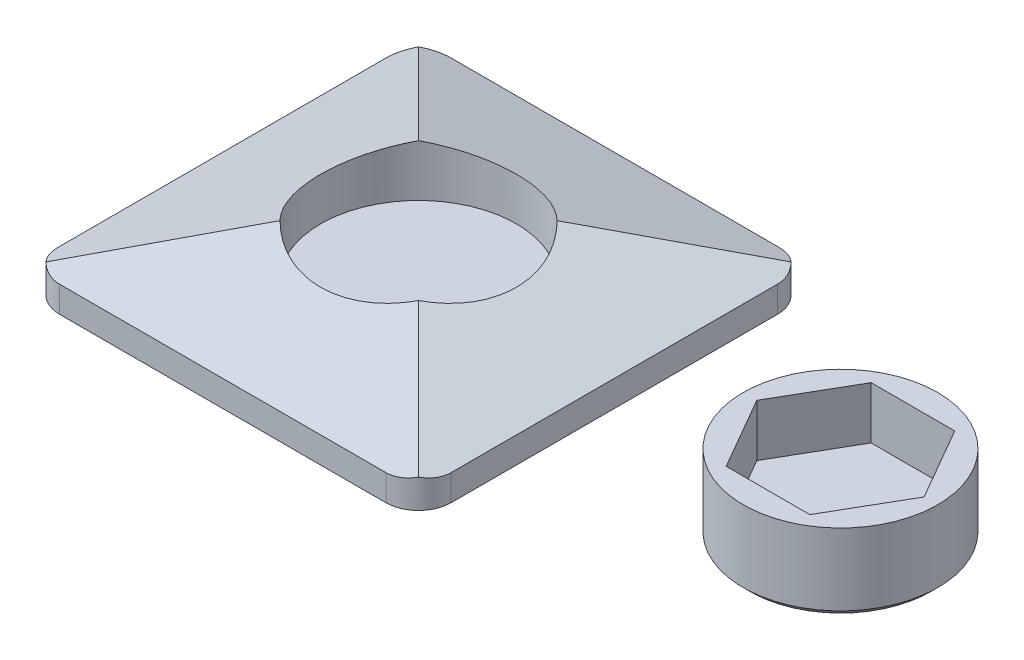
from build123d import *

# Parameters (mm, degrees)
CROQUIS1_W              = 60
CROQUIS1_H              = 60
SALIENTE_EXTRUIR1_DEPTH = 10
CROQUIS2_R              = 15
CORTAR_EXTRUIR1_DEPTH   = 8
CROQUIS3_R              = 14.9
SALIENTE_EXTRUIR2_DEPTH = 12
CORTAR_EXTRUIR2_DEPTH   = 8
CHAFL_N1_SIZE           = 1
CHAFL_N2_SIZE           = 6
CHAFL_N2_SIZE_2         = 19.625115711
REDONDEO1_R             = 5


with BuildPart() as part:
    # Croquis1 → Saliente-Extruir1 (new body)
    with BuildSketch(Plane(origin=(0, 0, 0), x_dir=(1, 0, 0), z_dir=(0, 1, 0))):
        Rectangle(CROQUIS1_W, CROQUIS1_H)
    extrude(amount=SALIENTE_EXTRUIR1_DEPTH)

    # Croquis2 → Cortar-Extruir1 (cut)
    with BuildSketch(Plane(origin=(0, 10, 0), x_dir=(1, 0, 0), z_dir=(0, 1, 0))):
        with Locations(Location((0, 0, 0), (0, 0, 270))):
            Circle(CROQUIS2_R)
    extrude(amount=-CORTAR_EXTRUIR1_DEPTH, mode=Mode.SUBTRACT)

    # Chaflán2
    # the kernel refuses this chamfer: 19.625115711, 6 mm, written as the material it takes off along each edge
    with BuildSketch(Plane(origin=(-80.942779868, 10, -30), x_dir=(0, -0.9928170985366542, -0.11964200288050775), z_dir=(1, 0, 0)), Plane(origin=(-30, 10, 80.942779868), x_dir=(-0.11964200288050775, -0.9928170985366542, 0), z_dir=(0, 0, -1)), Plane(origin=(30, 10, -80.942779868), x_dir=(0.11964200288050775, -0.9928170985366542, 0), z_dir=(0, 0, 1))) as chafl_n2_piece_1:
        Polygon((CHAFL_N2_SIZE * 0.992817098537, -CHAFL_N2_SIZE * 0.119642002881), (-CHAFL_N2_SIZE_2 * 0.11964200288, -CHAFL_N2_SIZE_2 * 0.992817098532), (0, 0), align=None)
    extrude(amount=161.885559735, mode=Mode.SUBTRACT)
    with BuildSketch(Plane(origin=(80.942779868, 10, 30), x_dir=(0, 0.011263281176818222, -0.9999365672367082), z_dir=(-1, 0, 0))) as chafl_n2_piece_2:
        Polygon((CHAFL_N2_SIZE_2 * 0.999936567232, CHAFL_N2_SIZE_2 * 0.0112632811768), (-CHAFL_N2_SIZE * 0.0112632811768, CHAFL_N2_SIZE * 0.999936567237), (0, 0), align=None)
    extrude(amount=161.885559735, mode=Mode.SUBTRACT)

    # Redondeo1
    redondeo1_edges = [part.edges().sort_by_distance(p)[0] for p in [
        (-30, 2, -30),
        (30, 2, -30),
        (-30, 2, 30),
        (30, 2, 30),
    ]]
    fillet(redondeo1_edges, radius=REDONDEO1_R)


with BuildPart() as body_2:
    # Croquis3 → Saliente-Extruir2 (new body)
    with BuildSketch(Plane.XZ):
        with Locations(Location((64.64183589, 0, 0), (0, 0, 270))):
            Circle(CROQUIS3_R)
    extrude(amount=-SALIENTE_EXTRUIR2_DEPTH)

    # Croquis4 → Cortar-Extruir2 (cut)
    with BuildSketch(Plane(origin=(0, 12, 0), x_dir=(1, 0, 0), z_dir=(0, 1, 0))):
        Polygon((77.459011866, 0), (71.050423878, 11.1), (58.233247902, 11.1), (51.824659914, 0), (58.233247902, -11.1), (71.050423878, -11.1), align=None)
    extrude(amount=-CORTAR_EXTRUIR2_DEPTH, mode=Mode.SUBTRACT)

    # Chaflán1
    chafl_n1_edges = [body_2.edges().sort_by_distance(p)[0] for p in [
        (64.64183589, 0, 14.9),
    ]]
    chamfer(chafl_n1_edges, length=CHAFL_N1_SIZE)


solid = Compound([part.part, body_2.part])
